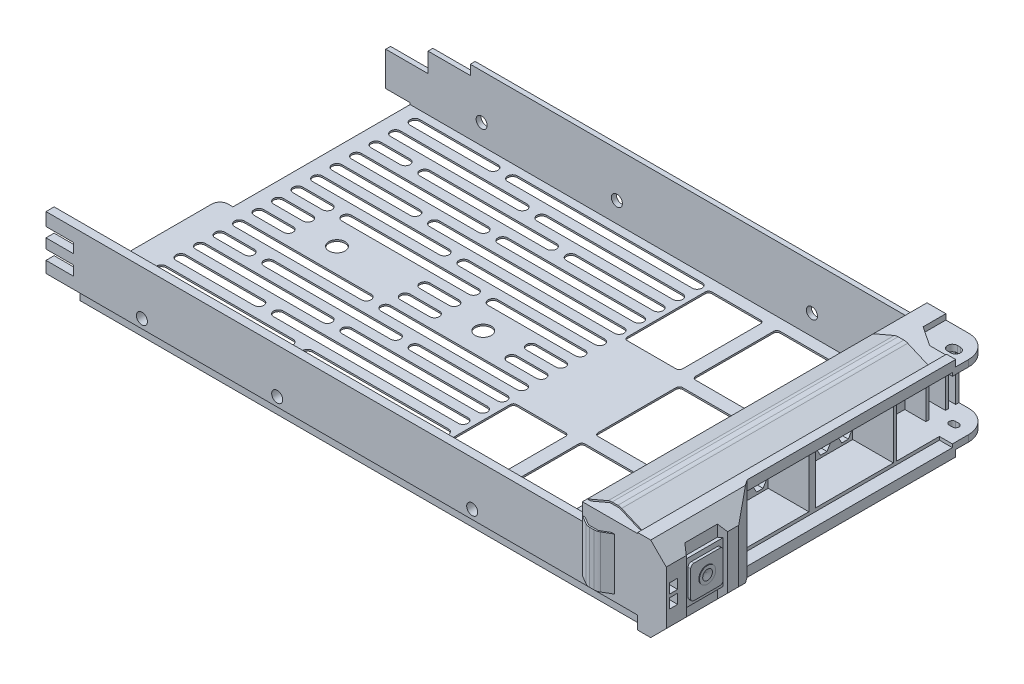
from build123d import *

# Parameters (mm, degrees)
SKETCH_2_W                  = 191
SKETCH_2_H                  = 106
EXTRUDE_1_DEPTH             = 26
SKETCH_3_W                  = 165
SKETCH_3_H                  = 106
CUT_EXTRUDE_1_DEPTH         = 5.5
SKETCH_4_W                  = 102
SKETCH_4_H                  = 20
CUT_EXTRUDE_2_DEPTH         = 165
SKETCH_5_W                  = 17
SKETCH_5_H                  = 106
CUT_EXTRUDE_3_DEPTH         = 0.3
CUT_EXTRUDE_4_DEPTH         = 200.91498193
CUT_EXTRUDE_5_DEPTH         = 200.850569176
FILLET_1_R                  = 2.5
SKETCH_10_W                 = 2.5
SKETCH_10_H                 = 3
CUT_EXTRUDE_7_DEPTH         = 26
SKETCH_13_W                 = 182
SKETCH_13_H                 = 4
CUT_EXTRUDE_9_DEPTH         = 2
SKETCH_14_W                 = 8.5
SKETCH_14_H                 = 4
CUT_EXTRUDE_10_DEPTH        = 0.5
SKETCH_15_W                 = 8.5
SKETCH_15_H                 = 3
CUT_EXTRUDE_11_DEPTH        = 2.5
CUT_EXTRUDE_12_DEPTH        = 1.5
HOLE_WIZARD_M3_1_REACH      = 221.984
HOLE_WIZARD_M3_1_BORE_R     = 1.7
SKETCH_23_W                 = 7.5
SKETCH_23_H                 = 1
CUT_EXTRUDE_15_DEPTH        = 1.5
PATTERN_LINEAR_1_COUNT      = 2
PATTERN_LINEAR_1_PITCH      = 41.61
PATTERN_LINEAR_1_COL_COUNT  = 2
PATTERN_LINEAR_1_COL_PITCH  = 101.6
MIRROR_START                = 50
MIRROR_1_OUTLINE_R          = 1.7
MIRROR_1_DEPTH              = 4
CHAMFER_1_SIZE              = 5
CUT_EXTRUDE_16_DEPTH        = 200.91498193
EXTRUDE_2_DEPTH             = 6.5
SKETCH_29_W                 = 10
SKETCH_29_H                 = 10
EXTRUDE_3_DEPTH             = 1
FILLET_2_R                  = 1
SKETCH_30_W                 = 17
SKETCH_30_H                 = 26
CUT_EXTRUDE_17_DEPTH        = 200.850569176
PATTERN_LINEAR_2_COUNT      = 3
PATTERN_LINEAR_2_PITCH      = 30
PATTERN_LINEAR_2_COUNT_DIR2 = 2
PATTERN_LINEAR_2_PITCH_DIR2 = 21
SKETCH_31_W                 = 17
SKETCH_31_H                 = 26
CUT_EXTRUDE_18_DEPTH        = 200.850569176
FILLET_3_R                  = 1
CUT_EXTRUDE_19_DEPTH        = 0.5
PATTERN_LINEAR_3_COUNT      = 2
PATTERN_LINEAR_3_PITCH      = 24
PATTERN_LINEAR_3_COL_COUNT  = 2
PATTERN_LINEAR_3_COL_PITCH  = 72
CUT_EXTRUDE_20_DEPTH        = 0.5
PATTERN_LINEAR_4_COUNT      = 3
PATTERN_LINEAR_4_PITCH      = 12
PATTERN_LINEAR_4_COUNT_DIR2 = 2
PATTERN_LINEAR_4_PITCH_DIR2 = 48
CUT_EXTRUDE_21_DEPTH        = 1
PATTERN_LINEAR_5_COUNT      = 4
PATTERN_LINEAR_5_PITCH      = 24
CUT_EXTRUDE_22_DEPTH        = 0.5
PATTERN_LINEAR_6_COUNT      = 2
PATTERN_LINEAR_6_PITCH      = 6
SKETCH_37_R                 = 2.5
CUT_EXTRUDE_23_DEPTH        = 0.5
SKETCH_38_W                 = 23
SKETCH_38_H                 = 18
SKETCH_38_W_2               = 25.145482358
SKETCH_38_W_3               = 24
CUT_EXTRUDE_24_DEPTH        = 16.5
FILLET_4_R                  = 7
CUT_EXTRUDE_25_DEPTH        = 2
SKETCH_40_W                 = 63.145482358
SKETCH_40_H                 = 20
CUT_EXTRUDE_26_DEPTH        = 4
SKETCH_42_OUTSIDE_W         = 151.996
SKETCH_42_OUTSIDE_H         = 71.996
SKETCH_42_OUTSIDE_R         = 2.5
CUT_EXTRUDE_27_DEPTH        = 0.2
CUT_EXTRUDE_28_DEPTH        = 2
CUT_EXTRUDE_29_DEPTH        = 2
SKETCH_46_W                 = 1
SKETCH_46_H                 = 18
EXTRUDE_4_DEPTH             = 6.5
SKETCH_47_R                 = 0.75
EXTRUDE_5_DEPTH             = 4
CUT_EXTRUDE_30_DEPTH        = 3.3
OTHER_START                 = 165
OTHER_3_DEPTH               = 3.3
EXTRUDE_6_DEPTH             = 88
FILLET_5_R                  = 3
EXTRUDE_8_DEPTH             = 16
FILLET_6_R                  = 3
FILLET_6_OF_MIRROR_4_R      = 3


with BuildPart() as part:
    # 草图2 → 凸台-拉伸1 (new body)
    with BuildSketch(Plane(origin=(0, 0, 0), x_dir=(1, 0, 0), z_dir=(0, 1, 0))):
        with Locations((95.5, 0)):
            Rectangle(SKETCH_2_W, SKETCH_2_H)
    extrude(amount=EXTRUDE_1_DEPTH)

    # 草图3 → 切除-拉伸1 (cut)
    with BuildSketch(Plane(origin=(0, 26, 0), x_dir=(1, 0, 0), z_dir=(0, 1, 0))):
        with Locations((82.5, 0)):
            Rectangle(SKETCH_3_W, SKETCH_3_H)
    extrude(amount=-CUT_EXTRUDE_1_DEPTH, mode=Mode.SUBTRACT)

    # 草图4 → 切除-拉伸2 (cut)
    with BuildSketch(Plane.ZY):
        with Locations((-0.5, 10.5)):
            Rectangle(SKETCH_4_W, SKETCH_4_H)
    extrude(amount=-CUT_EXTRUDE_2_DEPTH, mode=Mode.SUBTRACT)

    # 草图5 → 切除-拉伸3 (cut)
    with BuildSketch(Plane(origin=(0, 26, 0), x_dir=(1, 0, 0), z_dir=(0, 1, 0))):
        with Locations((173.5, 0)):
            Rectangle(SKETCH_5_W, SKETCH_5_H)
    extrude(amount=-CUT_EXTRUDE_3_DEPTH, mode=Mode.SUBTRACT)

    # 草图7 → 切除-拉伸4 (cut, through all)
    with BuildSketch(Plane(origin=(0, 26, 0), x_dir=(1, 0, 0), z_dir=(0, 1, 0))):
        Polygon((184.8, 53), (184.8, -22.145482358), (191, -31), (191, 53), align=None)
    extrude(amount=-CUT_EXTRUDE_4_DEPTH, mode=Mode.SUBTRACT)

    # 草图8 → 切除-拉伸5 (cut, through all)
    with BuildSketch(Plane(origin=(0, 0.5, 0), x_dir=(1, 0, 0), z_dir=(0, 1, 0))):
        Polygon((0, 51.5), (7.5, 51.5), (7.5, -3), (3.5, -3), (3.5, -43), (8.5, -43), (8.5, -50.5), (0, -50.5), align=None)
    extrude(amount=-CUT_EXTRUDE_5_DEPTH, mode=Mode.SUBTRACT)

    # 圆角1
    fillet_1_edges = [part.edges().sort_by_distance(p)[0] for p in [
        (3.5, 0.25, 3),
        (3.5, 0.25, 43),
    ]]
    fillet(fillet_1_edges, radius=FILLET_1_R)

    # 草图10 → 切除-拉伸7 (cut)
    with BuildSketch(Plane(origin=(191, 0, 0), x_dir=(0, 0, -1), z_dir=(1, 0, 0))):
        with Locations((-50.75, 11)):
            Rectangle(SKETCH_10_W, SKETCH_10_H)
        with Locations((-50.75, 15)):
            Rectangle(SKETCH_10_W, SKETCH_10_H)
    extrude(amount=-CUT_EXTRUDE_7_DEPTH, mode=Mode.SUBTRACT)

    # 草图13 → 切除-拉伸9 (cut)
    with BuildSketch(Plane.XY.offset(53)):
        with Locations((91, 2)):
            Rectangle(SKETCH_13_W, SKETCH_13_H)
    extrude(amount=-CUT_EXTRUDE_9_DEPTH, mode=Mode.SUBTRACT)

    # 草图14 → 切除-拉伸10 (cut)
    with BuildSketch(Plane.XY.offset(51)):
        with Locations((4.25, 2)):
            Rectangle(SKETCH_14_W, SKETCH_14_H)
    extrude(amount=-CUT_EXTRUDE_10_DEPTH, mode=Mode.SUBTRACT)

    # 草图15 → 切除-拉伸11 (cut)
    with BuildSketch(Plane.XY.offset(53)):
        with Locations((4.25, 15)):
            Rectangle(SKETCH_15_W, SKETCH_15_H)
        with Locations((4.25, 9)):
            Rectangle(SKETCH_15_W, SKETCH_15_H)
    extrude(amount=-CUT_EXTRUDE_11_DEPTH, mode=Mode.SUBTRACT)

    # 草图17 → 切除-拉伸12 (cut)
    with BuildSketch(Plane(origin=(0, 0, 50.5), x_dir=(-1, 0, 0), z_dir=(0, 0, -1))):
        with BuildLine():
            Line((0, 16.5), (-165, 16.5))
            Line((-165, 16.5), (-165, 9.5))
            Line((-165, 9.5), (-21, 9.5))
            Line((-21, 9.5), (-8.5, 7.5))
            Line((-8.5, 7.5), (0, 7.5))
            Line((0, 7.5), (0, 10.5))
            Line((0, 10.5), (-8.5, 10.5))
            Line((-8.5, 10.5), (-20.545527709, 12.427284433))
            ThreePointArc((-20.545527709, 12.427284433), (-20.99830261, 13.003024751), (-20.460252775, 13.5))
            Line((-20.460252775, 13.5), (0, 13.5))
            Line((0, 13.5), (0, 16.5))
        make_face()
    extrude(amount=-CUT_EXTRUDE_12_DEPTH, mode=Mode.SUBTRACT)

    # M3 间隙孔1 bore → M3 间隙孔1 (cut, up to next)
    with BuildSketch(Plane(origin=(0, 0, -53), x_dir=(-1, 0, 0), z_dir=(0, 0, -1)), mode=Mode.PRIVATE) as hole_wizard_m3_1_sk1:
        with Locations((-29.5, 6.75)):
            Circle(HOLE_WIZARD_M3_1_BORE_R)
    hole_wizard_m3_1_tool1 = extrude(hole_wizard_m3_1_sk1.sketch, amount=-HOLE_WIZARD_M3_1_REACH, mode=Mode.PRIVATE) & part.part
    hole_wizard_m3_1 = hole_wizard_m3_1_tool1.solids().sort_by_distance((29.5, 6.75, -53))[0]
    add(hole_wizard_m3_1, mode=Mode.SUBTRACT)

    # 草图23 → 切除-拉伸15 (cut)
    with BuildSketch(Plane(origin=(0, 0, -53), x_dir=(-1, 0, 0), z_dir=(0, 0, -1))):
        Polygon((0, 20.5), (-26, 20.5), (-26, 17.5), (-13, 17.5), (-13, 11.5), (0, 11.5), align=None)
        with Locations((-3.75, 0.5)):
            Rectangle(SKETCH_23_W, SKETCH_23_H)
    extrude(amount=-CUT_EXTRUDE_15_DEPTH, mode=Mode.SUBTRACT)

    # 阵列(线性)1: M3 间隙孔1 ×2
    with Locations(*[(i * PATTERN_LINEAR_1_PITCH, 0, 0) for i in range(1, PATTERN_LINEAR_1_COUNT)]):
        add(hole_wizard_m3_1, mode=Mode.SUBTRACT)

    # 阵列(线性)1 col: M3 间隙孔1 ×2
    with Locations(*[(i * PATTERN_LINEAR_1_COL_PITCH, 0, 0) for i in range(1, PATTERN_LINEAR_1_COL_COUNT)]):
        add(hole_wizard_m3_1, mode=Mode.SUBTRACT)

    # 镜向1: read off the stored shape, not the designer's step
    # 镜向1 outline → 镜向1 (cut)
    with BuildSketch(Plane.XY.offset(MIRROR_START)):
        with Locations((29.5, 6.75)):
            Circle(MIRROR_1_OUTLINE_R)
        with Locations((131.1, 6.75)):
            Circle(MIRROR_1_OUTLINE_R)
        with Locations((71.11, 6.75)):
            Circle(MIRROR_1_OUTLINE_R)
    extrude(amount=MIRROR_1_DEPTH, mode=Mode.SUBTRACT)

    # 倒角1
    chamfer_1_edges = [part.edges().sort_by_distance(p)[0] for p in [
        (191, 26, 42),
        (191, 0, 42),
    ]]
    chamfer(chamfer_1_edges, length=CHAMFER_1_SIZE)

    # 草图25 → 切除-拉伸16 (cut, through all)
    with BuildSketch(Plane.XZ):
        Polygon((191, 47), (189, 45.5), (189, 35.5), (191, 34), align=None)
    extrude(amount=-CUT_EXTRUDE_16_DEPTH, mode=Mode.SUBTRACT)

    # 草图28 → 凸台-拉伸2 (add, symmetric)
    with BuildSketch(Plane(origin=(0, 13, 0), x_dir=(-1, 0, 0), z_dir=(0, -1, 0))):
        Polygon((-189, -45.5), (-189, -35.5), (-190, -34.75), (-190, -46.25), align=None)
    extrude(amount=EXTRUDE_2_DEPTH, both=True)

    # 草图29 → 凸台-拉伸3 (add)
    with BuildSketch(Plane(origin=(190, 0, 0), x_dir=(0, 0, -1), z_dir=(1, 0, 0))):
        with Locations((-40.5, 13)):
            Rectangle(SKETCH_29_W, SKETCH_29_H)
    extrude(amount=EXTRUDE_3_DEPTH)

    # 圆角2
    fillet_2_edges = [part.edges().sort_by_distance(p)[0] for p in [
        (190.5, 18, 45.5),
        (190.5, 8, 45.5),
        (190.5, 8, 35.5),
        (190.5, 18, 35.5),
    ]]
    fillet(fillet_2_edges, radius=FILLET_2_R)

    # 草图30 → 切除-拉伸17 (cut, through all)
    with BuildSketch(Plane(origin=(0, 0.5, 0), x_dir=(1, 0, 0), z_dir=(0, 1, 0))):
        with Locations((153.3, 35)):
            Rectangle(SKETCH_30_W, SKETCH_30_H)
    cut_extrude_17 = extrude(amount=-CUT_EXTRUDE_17_DEPTH, mode=Mode.SUBTRACT)

    # 阵列(线性)2: Cut-Extrude 17 3 × 2
    with Locations(*[(-j * PATTERN_LINEAR_2_PITCH_DIR2, 0, i * PATTERN_LINEAR_2_PITCH) for i in range(PATTERN_LINEAR_2_COUNT) for j in range(PATTERN_LINEAR_2_COUNT_DIR2) if (i, j) != (0, 0)]):
        add(cut_extrude_17, mode=Mode.SUBTRACT)

    # 草图31 → 切除-拉伸18 (cut, through all)
    with BuildSketch(Plane(origin=(0, 0.5, 0), x_dir=(1, 0, 0), z_dir=(0, 1, 0))):
        with Locations((111.3, 35)):
            Rectangle(SKETCH_31_W, SKETCH_31_H)
        with Locations((111.3, -25)):
            Rectangle(SKETCH_31_W, SKETCH_31_H)
    extrude(amount=-CUT_EXTRUDE_18_DEPTH, mode=Mode.SUBTRACT)

    # 圆角3
    fillet_3_edges = [part.edges().sort_by_distance(p)[0] for p in [
        (144.8, 0.25, -22),
        (144.8, 0.25, -48),
        (161.8, 0.25, -48),
        (161.8, 0.25, -22),
        (144.8, 0.25, 8),
        (144.8, 0.25, -18),
        (161.8, 0.25, -18),
        (161.8, 0.25, 8),
        (144.8, 0.25, 38),
        (144.8, 0.25, 12),
        (161.8, 0.25, 12),
        (161.8, 0.25, 38),
        (123.8, 0.25, -22),
        (123.8, 0.25, -48),
        (140.8, 0.25, -48),
        (140.8, 0.25, -22),
        (123.8, 0.25, 8),
        (123.8, 0.25, -18),
        (140.8, 0.25, -18),
        (140.8, 0.25, 8),
        (123.8, 0.25, 38),
        (123.8, 0.25, 12),
        (140.8, 0.25, 12),
        (140.8, 0.25, 38),
        (102.8, 0.25, -22),
        (102.8, 0.25, -48),
        (119.8, 0.25, -48),
        (119.8, 0.25, -22),
        (102.8, 0.25, 38),
        (102.8, 0.25, 12),
        (119.8, 0.25, 12),
        (119.8, 0.25, 38),
    ]]
    fillet(fillet_3_edges, radius=FILLET_3_R)

    # 草图32 → 切除-拉伸19 (cut)
    with BuildSketch(Plane.XZ):
        with BuildLine():
            Line((13, -46), (37, -46))
            ThreePointArc((37, -46), (38.5, -47.5), (37, -49))
            Line((37, -49), (13, -49))
            ThreePointArc((13, -49), (11.5, -47.5), (13, -46))
        make_face()
        with BuildLine():
            Line((43, -46), (99.8, -46))
            ThreePointArc((99.8, -46), (101.3, -47.5), (99.8, -49))
            Line((99.8, -49), (43, -49))
            ThreePointArc((43, -49), (41.5, -47.5), (43, -46))
        make_face()
    cut_extrude_19 = extrude(amount=-CUT_EXTRUDE_19_DEPTH, mode=Mode.SUBTRACT)

    # 阵列(线性)3: 切除-拉伸19 ×2
    with Locations(*[(0, 0, i * PATTERN_LINEAR_3_PITCH) for i in range(1, PATTERN_LINEAR_3_COUNT)]):
        add(cut_extrude_19, mode=Mode.SUBTRACT)

    # 阵列(线性)3 col: 切除-拉伸19 ×2
    with Locations(*[(0, 0, i * PATTERN_LINEAR_3_COL_PITCH) for i in range(1, PATTERN_LINEAR_3_COL_COUNT)]):
        add(cut_extrude_19, mode=Mode.SUBTRACT)

    # 草图33 → 切除-拉伸20 (cut)
    with BuildSketch(Plane.XZ):
        with BuildLine():
            Line((13, -40), (52, -40))
            ThreePointArc((52, -40), (53.5, -41.5), (52, -43))
            Line((52, -43), (13, -43))
            ThreePointArc((13, -43), (11.5, -41.5), (13, -40))
        make_face()
        with BuildLine():
            Line((58, -40), (99.8, -40))
            ThreePointArc((99.8, -40), (101.3, -41.5), (99.8, -43))
            Line((99.8, -43), (58, -43))
            ThreePointArc((58, -43), (56.5, -41.5), (58, -40))
        make_face()
    cut_extrude_20 = extrude(amount=-CUT_EXTRUDE_20_DEPTH, mode=Mode.SUBTRACT)

    # 阵列(线性)4: Cut-Extrude 20 3 × 2
    with Locations(*[Vector(0, 0, 1) * (i * PATTERN_LINEAR_4_PITCH) + Vector(0, 0, 1) * (j * PATTERN_LINEAR_4_PITCH_DIR2) for i in range(PATTERN_LINEAR_4_COUNT) for j in range(PATTERN_LINEAR_4_COUNT_DIR2) if (i, j) != (0, 0)]):
        add(cut_extrude_20, mode=Mode.SUBTRACT)

    # 草图34 → 切除-拉伸21 (cut)
    with BuildSketch(Plane.XZ):
        with BuildLine():
            Line((13, -34), (22, -34))
            ThreePointArc((22, -34), (23.5, -35.5), (22, -37))
            Line((22, -37), (13, -37))
            ThreePointArc((13, -37), (11.5, -35.5), (13, -34))
        make_face()
        with BuildLine():
            Line((28, -34), (67, -34))
            ThreePointArc((67, -34), (68.5, -35.5), (67, -37))
            Line((67, -37), (28, -37))
            ThreePointArc((28, -37), (26.5, -35.5), (28, -34))
        make_face()
        with BuildLine():
            Line((73, -34), (99.8, -34))
            ThreePointArc((99.8, -34), (101.3, -35.5), (99.8, -37))
            Line((99.8, -37), (73, -37))
            ThreePointArc((73, -37), (71.5, -35.5), (73, -34))
        make_face()
    cut_extrude_21 = extrude(amount=-CUT_EXTRUDE_21_DEPTH, mode=Mode.SUBTRACT)

    # 阵列(线性)5: 切除-拉伸21 ×4
    with Locations(*[(0, 0, i * PATTERN_LINEAR_5_PITCH) for i in range(1, PATTERN_LINEAR_5_COUNT)]):
        add(cut_extrude_21, mode=Mode.SUBTRACT)

    # 草图36 → 切除-拉伸22 (cut)
    with BuildSketch(Plane.XZ):
        with BuildLine():
            Line((13, -4), (22, -4))
            ThreePointArc((22, -4), (23.5, -5.5), (22, -7))
            Line((22, -7), (13, -7))
            ThreePointArc((13, -7), (11.5, -5.5), (13, -4))
        make_face()
        with BuildLine():
            Line((58, -4), (67, -4))
            ThreePointArc((67, -4), (68.5, -5.5), (67, -7))
            Line((67, -7), (58, -7))
            ThreePointArc((58, -7), (56.5, -5.5), (58, -4))
        make_face()
        with BuildLine():
            Line((90.8, -4), (99.8, -4))
            ThreePointArc((99.8, -4), (101.3, -5.5), (99.8, -7))
            Line((99.8, -7), (90.8, -7))
            ThreePointArc((90.8, -7), (89.3, -5.5), (90.8, -4))
        make_face()
    cut_extrude_22 = extrude(amount=-CUT_EXTRUDE_22_DEPTH, mode=Mode.SUBTRACT)

    # 阵列(线性)6: 切除-拉伸22 ×2
    with Locations(*[(0, 0, i * PATTERN_LINEAR_6_PITCH) for i in range(1, PATTERN_LINEAR_6_COUNT)]):
        add(cut_extrude_22, mode=Mode.SUBTRACT)

    # 草图37 → 切除-拉伸23 (cut)
    with BuildSketch(Plane.XZ):
        with Locations(Location((34, -2.5, 0), (0, 0, 270))):
            Circle(SKETCH_37_R)
        with Locations(Location((79, -2.5, 0), (0, 0, 270))):
            Circle(SKETCH_37_R)
    extrude(amount=-CUT_EXTRUDE_23_DEPTH, mode=Mode.SUBTRACT)

    # 草图38 → 切除-拉伸24 (cut)
    with BuildSketch(Plane(origin=(184.8, 0, 0), x_dir=(0, 0, -1), z_dir=(1, 0, 0))):
        with Locations((-10.645482358, 13)):
            Rectangle(SKETCH_38_W, SKETCH_38_H)
        with Locations((40.427258821, 13)):
            Rectangle(SKETCH_38_W_2, SKETCH_38_H)
        with Locations((14.854517642, 13)):
            Rectangle(SKETCH_38_W_3, SKETCH_38_H)
    extrude(amount=-CUT_EXTRUDE_24_DEPTH, mode=Mode.SUBTRACT)

    # 圆角4
    fillet_4_edges = [part.edges().sort_by_distance(p)[0] for p in [
        (184.8, 24, -53),
        (184.8, 2, -53),
    ]]
    fillet(fillet_4_edges, radius=FILLET_4_R)

    # 草图39 → 切除-拉伸25 (cut)
    with BuildSketch(Plane.XZ):
        with BuildLine():
            Line((184.8, -42), (176.8, -42))
            Line((176.8, -42), (170.8, -46))
            Line((170.8, -46), (170.8, -53))
            Line((170.8, -53), (177.8, -53))
            ThreePointArc((177.8, -53), (182.749747468, -50.949747468), (184.8, -46))
            Line((184.8, -46), (184.8, -42))
        make_face()
    cut_extrude_25 = extrude(amount=-CUT_EXTRUDE_25_DEPTH, mode=Mode.SUBTRACT)

    # 镜向3: 切除-拉伸25 across plane
    add(cut_extrude_25.mirror(Plane(origin=(0, 13, 0), x_dir=(0, 0, 1), z_dir=(0, -1, 0))), mode=Mode.SUBTRACT)

    # 草图40 → 切除-拉伸26 (cut)
    with BuildSketch(Plane(origin=(184.8, 0, 0), x_dir=(0, 0, -1), z_dir=(1, 0, 0))):
        with Locations((9.427258821, 13)):
            Rectangle(SKETCH_40_W, SKETCH_40_H)
    extrude(amount=-CUT_EXTRUDE_26_DEPTH, mode=Mode.SUBTRACT)

    # 草图42 outside → 切除-拉伸27 (cut)
    with BuildSketch(Plane(origin=(191, 0, 0), x_dir=(0, 0, -1), z_dir=(1, 0, 0))):
        with Locations((0, 13)):
            Rectangle(SKETCH_42_OUTSIDE_W, SKETCH_42_OUTSIDE_H)
        with Locations((-40.5, 13)):
            Circle(SKETCH_42_OUTSIDE_R, mode=Mode.SUBTRACT)
    extrude(amount=-CUT_EXTRUDE_27_DEPTH, mode=Mode.SUBTRACT)

    # 草图43 → 切除-旋转1 (revolve, cut)
    with BuildSketch(Plane(origin=(0, 13, 0), x_dir=(-1, 0, 0), z_dir=(0, -1, 0))):
        Polygon((-191, -40.5), (-191, -39), (-190.5, -40.5), align=None)
    revolve(axis=Axis((191, 13, 40.5), (1, 0, 0)), mode=Mode.SUBTRACT)

    # 草图44 → 切除-拉伸28 (cut)
    with BuildSketch(Plane.XZ.offset(-2)):
        with BuildLine():
            Line((179.3, -45.5), (180.3, -45.5))
            ThreePointArc((180.3, -45.5), (181.3, -46.5), (180.3, -47.5))
            Line((180.3, -47.5), (179.3, -47.5))
            ThreePointArc((179.3, -47.5), (178.3, -46.5), (179.3, -45.5))
        make_face()
    extrude(amount=-CUT_EXTRUDE_28_DEPTH, mode=Mode.SUBTRACT)

    # 草图45 → 切除-拉伸29 (cut)
    with BuildSketch(Plane(origin=(0, 24, 0), x_dir=(1, 0, 0), z_dir=(0, 1, 0))):
        with BuildLine():
            Line((179.3, 48), (180.3, 48))
            ThreePointArc((180.3, 48), (181.8, 46.5), (180.3, 45))
            Line((180.3, 45), (179.3, 45))
            ThreePointArc((179.3, 45), (177.8, 46.5), (179.3, 48))
        make_face()
    extrude(amount=-CUT_EXTRUDE_29_DEPTH, mode=Mode.SUBTRACT)

    # 草图46 → 凸台-拉伸4 (add)
    with BuildSketch(Plane(origin=(168.3, 0, 0), x_dir=(0, 0, -1), z_dir=(1, 0, 0))):
        with Locations((43.354517642, 13)):
            Rectangle(SKETCH_46_W, SKETCH_46_H)
        with Locations((49.354517642, 13)):
            Rectangle(SKETCH_46_W, SKETCH_46_H)
        with Locations((52.5, 13)):
            Rectangle(SKETCH_46_W, SKETCH_46_H)
    extrude(amount=EXTRUDE_4_DEPTH)

    # 草图47 → 凸台-拉伸5 (add)
    with BuildSketch(Plane(origin=(168.3, 0, 0), x_dir=(0, 0, -1), z_dir=(1, 0, 0))):
        with Locations(Location((46.5, 13, 0), (0, 0, 180))):
            Circle(SKETCH_47_R)
    extrude(amount=EXTRUDE_5_DEPTH)

    # 草图49 → 切除-拉伸30 (cut)
    with BuildSketch(Plane.ZY.offset(-165)):
        Polygon((-22.5, 20.267949192), (-23.5, 22), (-25.5, 22), (-26.5, 20.267949192), (-25.5, 18.535898385), (-23.5, 18.535898385), align=None)
    extrude(amount=-CUT_EXTRUDE_30_DEPTH, mode=Mode.SUBTRACT)

    # 填充阵列3: read off the stored shape, not the designer's step
    # 填充阵列3 outline → 填充阵列3 (cut)
    with BuildSketch(Plane.YZ.offset(OTHER_START)):
        Polygon((20.267949192, -0.287134583), (22, 0.712865417), (22, 2.712865417), (20.267949192, 3.712865417), (18.535898385, 2.712865417), (18.535898385, 0.712865417), align=None)
        Polygon((20.267949192, 19.37251448), (22, 20.37251448), (22, 22.37251448), (20.267949192, 23.37251448), (18.535898385, 22.37251448), (18.535898385, 20.37251448), align=None)
        Polygon((20.267949192, 12.819298126), (22, 13.819298126), (22, 15.819298126), (20.267949192, 16.819298126), (18.535898385, 15.819298126), (18.535898385, 13.819298126), align=None)
        Polygon((20.267949192, 6.266081772), (22, 7.266081772), (22, 9.266081772), (20.267949192, 10.266081772), (18.535898385, 9.266081772), (18.535898385, 7.266081772), align=None)
        Polygon((20.267949192, -19.946783646), (22, -18.946783646), (22, -16.946783646), (20.267949192, -15.946783646), (18.535898385, -16.946783646), (18.535898385, -18.946783646), align=None)
        Polygon((20.267949192, -6.840350937), (22, -5.840350937), (22, -3.840350937), (20.267949192, -2.840350937), (18.535898385, -3.840350937), (18.535898385, -5.840350937), align=None)
        Polygon((20.267949192, -13.393567291), (22, -12.393567291), (22, -10.393567291), (20.267949192, -9.393567291), (18.535898385, -10.393567291), (18.535898385, -12.393567291), align=None)
        Polygon((17.411388509, -3.840350937), (15.679337702, -2.840350937), (13.947286894, -3.840350937), (13.947286894, -5.840350937), (15.679337702, -6.840350937), (17.411388509, -5.840350937), align=None)
        Polygon((15.679337702, 16.819298126), (13.947286894, 15.819298126), (13.947286894, 13.819298126), (15.679337702, 12.819298126), (17.411388509, 13.819298126), (17.411388509, 15.819298126), align=None)
        Polygon((15.679337702, 3.712865417), (13.947286894, 2.712865417), (13.947286894, 0.712865417), (15.679337702, -0.287134583), (17.411388509, 0.712865417), (17.411388509, 2.712865417), align=None)
        Polygon((15.679337702, -9.393567291), (13.947286894, -10.393567291), (13.947286894, -12.393567291), (15.679337702, -13.393567291), (17.411388509, -12.393567291), (17.411388509, -10.393567291), align=None)
        Polygon((15.679337702, -15.946783646), (13.947286894, -16.946783646), (13.947286894, -18.946783646), (15.679337702, -19.946783646), (17.411388509, -18.946783646), (17.411388509, -16.946783646), align=None)
        Polygon((15.679337702, -22.5), (13.947286894, -23.5), (13.947286894, -25.5), (15.679337702, -26.5), (17.411388509, -25.5), (17.411388509, -23.5), align=None)
        Polygon((15.679337702, 23.37251448), (13.947286894, 22.37251448), (13.947286894, 20.37251448), (15.679337702, 19.37251448), (17.411388509, 20.37251448), (17.411388509, 22.37251448), align=None)
        Polygon((15.679337702, 10.266081772), (13.947286894, 9.266081772), (13.947286894, 7.266081772), (15.679337702, 6.266081772), (17.411388509, 7.266081772), (17.411388509, 9.266081772), align=None)
        Polygon((19.705694255, -0.56374276), (17.973643447, 0.43625724), (16.241592639, -0.56374276), (16.241592639, -2.56374276), (17.973643447, -3.56374276), (19.705694255, -2.56374276), align=None)
        Polygon((17.973643447, 20.095906303), (16.241592639, 19.095906303), (16.241592639, 17.095906303), (17.973643447, 16.095906303), (19.705694255, 17.095906303), (19.705694255, 19.095906303), align=None)
        Polygon((17.973643447, 6.989473594), (16.241592639, 5.989473594), (16.241592639, 3.989473594), (17.973643447, 2.989473594), (19.705694255, 3.989473594), (19.705694255, 5.989473594), align=None)
        Polygon((17.973643447, 13.542689949), (16.241592639, 12.542689949), (16.241592639, 10.542689949), (17.973643447, 9.542689949), (19.705694255, 10.542689949), (19.705694255, 12.542689949), align=None)
        Polygon((17.973643447, -6.116959114), (16.241592639, -7.116959114), (16.241592639, -9.116959114), (17.973643447, -10.116959114), (19.705694255, -9.116959114), (19.705694255, -7.116959114), align=None)
        Polygon((17.973643447, -12.670175469), (16.241592639, -13.670175469), (16.241592639, -15.670175469), (17.973643447, -16.670175469), (19.705694255, -15.670175469), (19.705694255, -13.670175469), align=None)
        Polygon((17.973643447, -19.223391823), (16.241592639, -20.223391823), (16.241592639, -22.223391823), (17.973643447, -23.223391823), (19.705694255, -22.223391823), (19.705694255, -20.223391823), align=None)
        Polygon((8.234165528, -3.840350937), (6.50211472, -2.840350937), (4.770063912, -3.840350937), (4.770063912, -5.840350937), (6.50211472, -6.840350937), (8.234165528, -5.840350937), align=None)
        Polygon((6.50211472, 3.712865417), (4.770063912, 2.712865417), (4.770063912, 0.712865417), (6.50211472, -0.287134583), (8.234165528, 0.712865417), (8.234165528, 2.712865417), align=None)
        Polygon((6.50211472, 10.266081772), (4.770063912, 9.266081772), (4.770063912, 7.266081772), (6.50211472, 6.266081772), (8.234165528, 7.266081772), (8.234165528, 9.266081772), align=None)
        Polygon((6.50211472, 16.819298126), (4.770063912, 15.819298126), (4.770063912, 13.819298126), (6.50211472, 12.819298126), (8.234165528, 13.819298126), (8.234165528, 15.819298126), align=None)
        Polygon((6.50211472, 23.37251448), (4.770063912, 22.37251448), (4.770063912, 20.37251448), (6.50211472, 19.37251448), (8.234165528, 20.37251448), (8.234165528, 22.37251448), align=None)
        Polygon((6.50211472, -22.5), (4.770063912, -23.5), (4.770063912, -25.5), (6.50211472, -26.5), (8.234165528, -25.5), (8.234165528, -23.5), align=None)
        Polygon((6.50211472, -15.946783646), (4.770063912, -16.946783646), (4.770063912, -18.946783646), (6.50211472, -19.946783646), (8.234165528, -18.946783646), (8.234165528, -16.946783646), align=None)
        Polygon((6.50211472, -9.393567291), (4.770063912, -10.393567291), (4.770063912, -12.393567291), (6.50211472, -13.393567291), (8.234165528, -12.393567291), (8.234165528, -10.393567291), align=None)
        Polygon((12.822777018, -3.840350937), (11.090726211, -2.840350937), (9.358675403, -3.840350937), (9.358675403, -5.840350937), (11.090726211, -6.840350937), (12.822777018, -5.840350937), align=None)
        Polygon((11.090726211, 10.266081772), (9.358675403, 9.266081772), (9.358675403, 7.266081772), (11.090726211, 6.266081772), (12.822777018, 7.266081772), (12.822777018, 9.266081772), align=None)
        Polygon((11.090726211, 16.819298126), (9.358675403, 15.819298126), (9.358675403, 13.819298126), (11.090726211, 12.819298126), (12.822777018, 13.819298126), (12.822777018, 15.819298126), align=None)
        Polygon((11.090726211, 3.712865417), (9.358675403, 2.712865417), (9.358675403, 0.712865417), (11.090726211, -0.287134583), (12.822777018, 0.712865417), (12.822777018, 2.712865417), align=None)
        Polygon((11.090726211, -22.5), (9.358675403, -23.5), (9.358675403, -25.5), (11.090726211, -26.5), (12.822777018, -25.5), (12.822777018, -23.5), align=None)
        Polygon((11.090726211, -15.946783646), (9.358675403, -16.946783646), (9.358675403, -18.946783646), (11.090726211, -19.946783646), (12.822777018, -18.946783646), (12.822777018, -16.946783646), align=None)
        Polygon((11.090726211, 23.37251448), (9.358675403, 22.37251448), (9.358675403, 20.37251448), (11.090726211, 19.37251448), (12.822777018, 20.37251448), (12.822777018, 22.37251448), align=None)
        Polygon((11.090726211, -9.393567291), (9.358675403, -10.393567291), (9.358675403, -12.393567291), (11.090726211, -13.393567291), (12.822777018, -12.393567291), (12.822777018, -10.393567291), align=None)
        Polygon((15.117082764, -0.56374276), (13.385031956, 0.43625724), (11.652981149, -0.56374276), (11.652981149, -2.56374276), (13.385031956, -3.56374276), (15.117082764, -2.56374276), align=None)
        Polygon((13.385031956, 13.542689949), (11.652981149, 12.542689949), (11.652981149, 10.542689949), (13.385031956, 9.542689949), (15.117082764, 10.542689949), (15.117082764, 12.542689949), align=None)
        Polygon((13.385031956, 20.095906303), (11.652981149, 19.095906303), (11.652981149, 17.095906303), (13.385031956, 16.095906303), (15.117082764, 17.095906303), (15.117082764, 19.095906303), align=None)
        Polygon((13.385031956, 6.989473594), (11.652981149, 5.989473594), (11.652981149, 3.989473594), (13.385031956, 2.989473594), (15.117082764, 3.989473594), (15.117082764, 5.989473594), align=None)
        Polygon((13.385031956, -19.223391823), (11.652981149, -20.223391823), (11.652981149, -22.223391823), (13.385031956, -23.223391823), (15.117082764, -22.223391823), (15.117082764, -20.223391823), align=None)
        Polygon((13.385031956, -12.670175469), (11.652981149, -13.670175469), (11.652981149, -15.670175469), (13.385031956, -16.670175469), (15.117082764, -15.670175469), (15.117082764, -13.670175469), align=None)
        Polygon((13.385031956, -6.116959114), (11.652981149, -7.116959114), (11.652981149, -9.116959114), (13.385031956, -10.116959114), (15.117082764, -9.116959114), (15.117082764, -7.116959114), align=None)
        Polygon((10.528471273, -0.56374276), (8.796420465, 0.43625724), (7.064369658, -0.56374276), (7.064369658, -2.56374276), (8.796420465, -3.56374276), (10.528471273, -2.56374276), align=None)
        Polygon((8.796420465, 6.989473594), (7.064369658, 5.989473594), (7.064369658, 3.989473594), (8.796420465, 2.989473594), (10.528471273, 3.989473594), (10.528471273, 5.989473594), align=None)
        Polygon((8.796420465, 20.095906303), (7.064369658, 19.095906303), (7.064369658, 17.095906303), (8.796420465, 16.095906303), (10.528471273, 17.095906303), (10.528471273, 19.095906303), align=None)
        Polygon((8.796420465, 13.542689949), (7.064369658, 12.542689949), (7.064369658, 10.542689949), (8.796420465, 9.542689949), (10.528471273, 10.542689949), (10.528471273, 12.542689949), align=None)
        Polygon((8.796420465, -19.223391823), (7.064369658, -20.223391823), (7.064369658, -22.223391823), (8.796420465, -23.223391823), (10.528471273, -22.223391823), (10.528471273, -20.223391823), align=None)
        Polygon((8.796420465, -12.670175469), (7.064369658, -13.670175469), (7.064369658, -15.670175469), (8.796420465, -16.670175469), (10.528471273, -15.670175469), (10.528471273, -13.670175469), align=None)
        Polygon((8.796420465, -6.116959114), (7.064369658, -7.116959114), (7.064369658, -9.116959114), (8.796420465, -10.116959114), (10.528471273, -9.116959114), (10.528471273, -7.116959114), align=None)
    extrude(amount=OTHER_3_DEPTH, mode=Mode.SUBTRACT)

    # 草图51 → 凸台-拉伸6 (add)
    with BuildSketch(Plane.XY.offset(51.5)):
        Polygon((165, 25.7), (172, 28.7), (175, 28.7), (182, 25.7), (180.833333333, 25.7), (175, 28.2), (172, 28.2), (166.166666667, 25.7), align=None)
    extrude(amount=-EXTRUDE_6_DEPTH)

    # 圆角5
    fillet_5_edges = [part.edges().sort_by_distance(p)[0] for p in [
        (172, 28.7, 7.5),
        (175, 28.7, 7.5),
    ]]
    fillet(fillet_5_edges, radius=FILLET_5_R)

    # 草图52 → 凸台-拉伸8 (add)
    with BuildSketch(Plane.XZ.offset(-22)):
        Polygon((165, -53), (168.4, -55), (171.4, -55), (174.8, -53), (173.95, -53), (171.4, -54.5), (168.4, -54.5), (165.85, -53), align=None)
    extrude_8 = extrude(amount=EXTRUDE_8_DEPTH)

    # 圆角6
    fillet_6_edges = [part.edges().sort_by_distance(p)[0] for p in [
        (168.4, 14, -55),
        (171.4, 14, -55),
    ]]
    fillet(fillet_6_edges, radius=FILLET_6_R)

    # 镜向4: 凸台-拉伸8 across plane
    add(extrude_8.mirror(Plane.XY))

    # 圆角6 of 镜向4
    fillet_6_of_mirror_4_edges = [part.edges().sort_by_distance(p)[0] for p in [
        (168.4, 14, 55),
        (171.4, 14, 55),
    ]]
    fillet(fillet_6_of_mirror_4_edges, radius=FILLET_6_OF_MIRROR_4_R)


solid = part.part
